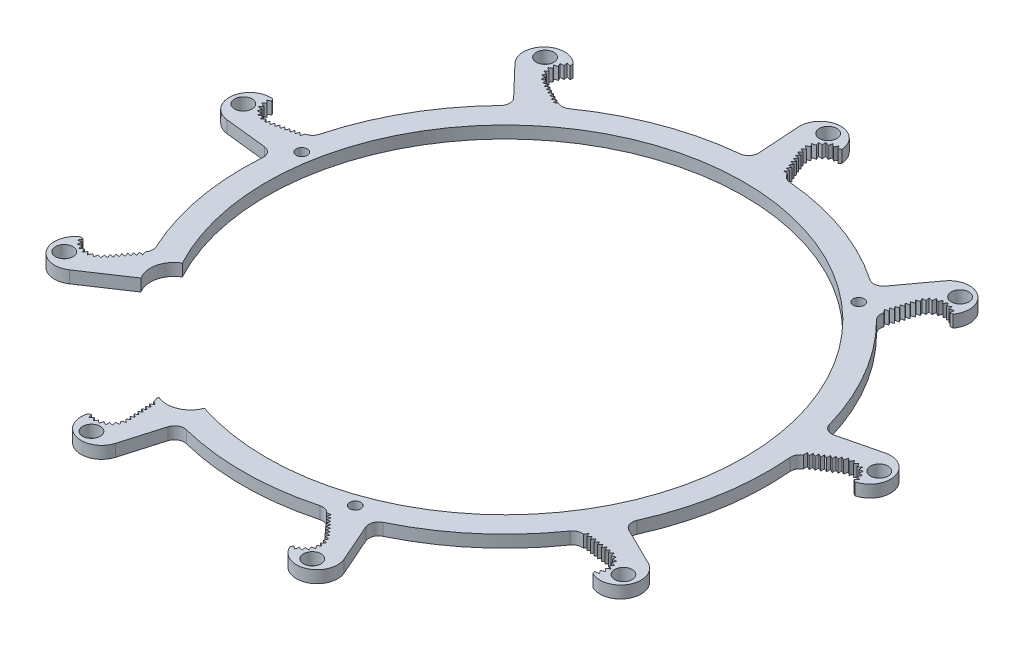
from build123d import *

# Parameters (mm, degrees)
SKETCH1_R           = 68.58
SKETCH1_R_2         = 55.88
BOSS_EXTRUDE1_DEPTH = 3.175
BOSS_EXTRUDE2_START = -3.175
BOSS_EXTRUDE2_DEPTH = 3.175
CIRPATTERN1_COUNT   = 9
SKETCH4_R           = 1.27
CUT_EXTRUDE1_DEPTH  = 124.088082607
CIRPATTERN14_COUNT  = 4
SKETCH5_R           = 62.357
CUT_EXTRUDE2_DEPTH  = 124.088082607
CUT_EXTRUDE3_DEPTH  = 124.088082607
SKETCH7_R           = 1.4605
CUT_EXTRUDE4_DEPTH  = 124.088082607
CIRPATTERN15_COUNT  = 3
CUT_EXTRUDE5_DEPTH  = 124.088082607
CRVPATTERN1_DEPTH   = 3.175
CIRPATTERN16_COUNT  = 9
CUT_EXTRUDE6_DEPTH  = 124.088082607
SKETCH3_R           = 2.286
CUT_EXTRUDE7_DEPTH  = 124.088082607
CIRPATTERN17_COUNT  = 9


# Read off the part's stored shape, not the designer's step: CrvPattern1
with BuildPart() as part:
    # Sketch1 → Boss-Extrude1 (new body)
    with BuildSketch(Plane(origin=(0, 0, 0), x_dir=(1, 0, 0), z_dir=(0, 1, 0))):
        with Locations(Location((0, 0, 0), (0, 0, 270))):
            Circle(SKETCH1_R)
        with Locations(Location((0, 0, 0), (0, 0, 270))):
            Circle(SKETCH1_R_2, mode=Mode.SUBTRACT)
    extrude(amount=BOSS_EXTRUDE1_DEPTH)

    # Sketch2 → Boss-Extrude2 (add)
    with BuildSketch(Plane(origin=(0, 3.175, 0), x_dir=(1, 0, 0), z_dir=(0, 1, 0)).offset(BOSS_EXTRUDE2_START)):
        with BuildLine():
            Line((-4.648503105, 70.922452149), (-5.367925957, 81.898723786))
            ThreePointArc((-5.367925957, 81.898723786), (0, 87.63), (5.367925957, 81.898723786))
            ThreePointArc((5.367925957, 81.898723786), (1.585103244, 80.66312392), (0.966324082, 76.732021396))
            Line((0.966324082, 76.732021396), (3.81, 69.87951531))
            ThreePointArc((3.81, 69.87951531), (4.65537594, 68.803759817), (5.936157335, 68.322605601))
            ThreePointArc((5.936157335, 68.322605601), (-0.497376724, 68.578196363), (-6.926526743, 68.22931648))
            ThreePointArc((-6.926526743, 68.22931648), (-5.243785443, 69.115963701), (-4.648503105, 70.922452149))
        make_face()
    boss_extrude2 = extrude(amount=BOSS_EXTRUDE2_DEPTH)

    # CirPattern1: Boss-Extrude2 ×9 about axis
    cirpattern1_axis = Axis((0, 0, 0), (0, 1, 0))
    for i in range(1, CIRPATTERN1_COUNT):
        add(boss_extrude2.rotate(cirpattern1_axis, i * 360 / CIRPATTERN1_COUNT))

    # Sketch4 → Cut-Extrude1 (cut, through all)
    with BuildSketch(Plane(origin=(0, 3.175, 0), x_dir=(1, 0, 0), z_dir=(0, 1, 0))):
        with Locations(Location((53.522006363, 24.957721447, 0), (0, 0, 270))):
            Circle(SKETCH4_R)
    cut_extrude1 = extrude(amount=-CUT_EXTRUDE1_DEPTH, mode=Mode.SUBTRACT)

    # CirPattern14: Cut-Extrude1 ×4 about axis
    cirpattern14_axis = Axis((0, 0, 0), (0, 1, 0))
    for i in range(1, CIRPATTERN14_COUNT):
        add(cut_extrude1.rotate(cirpattern14_axis, i * 360 / CIRPATTERN14_COUNT), mode=Mode.SUBTRACT)

    # Sketch5 → Cut-Extrude2 (cut, through all)
    with BuildSketch(Plane(origin=(0, 3.175, 0), x_dir=(1, 0, 0), z_dir=(0, 1, 0))):
        with Locations(Location((0, 0, 0), (0, 0, 270))):
            Circle(SKETCH5_R)
    extrude(amount=-CUT_EXTRUDE2_DEPTH, mode=Mode.SUBTRACT)

    # Sketch6 → Cut-Extrude3 (cut, through all)
    with BuildSketch(Plane(origin=(0, 3.175, 0), x_dir=(1, 0, 0), z_dir=(0, 1, 0))):
        with BuildLine():
            Line((-59.096393707, -39.486947853), (-51.847950614, -34.64369302))
            ThreePointArc((-51.847950614, -34.64369302), (-40.082306977, -47.76823334), (-25.11407534, -57.076077903))
            Line((-25.11407534, -57.076077903), (-27.81396741, -63.212049387))
            ThreePointArc((-27.81396741, -63.212049387), (-28.299348207, -62.604322733), (-28.945870603, -62.171962934))
            ThreePointArc((-28.945870603, -62.171962934), (-43.700202241, -52.853653839), (-55.625057983, -40.113206359))
            ThreePointArc((-55.625057983, -40.113206359), (-57.234287651, -39.099233257), (-59.096393707, -39.486947853))
        make_face()
    extrude(amount=-CUT_EXTRUDE3_DEPTH, mode=Mode.SUBTRACT)

    # Sketch7 → Cut-Extrude4 (cut, through all)
    with BuildSketch(Plane(origin=(0, 3.175, 0), x_dir=(1, 0, 0), z_dir=(0, 1, 0))):
        with Locations(Location((42.123157638, 50.200424446, 0), (0, 0, 270))):
            Circle(SKETCH7_R)
    cut_extrude4 = extrude(amount=-CUT_EXTRUDE4_DEPTH, mode=Mode.SUBTRACT)

    # CirPattern15: Cut-Extrude4 ×3 about axis
    cirpattern15_axis = Axis((0, 0, 0), (0, 1, 0))
    for i in range(1, CIRPATTERN15_COUNT):
        add(cut_extrude4.rotate(cirpattern15_axis, i * 360 / CIRPATTERN15_COUNT), mode=Mode.SUBTRACT)

    # Sketch9 → Cut-Extrude5 (cut, through all)
    with BuildSketch(Plane(origin=(0, 3.175, 0), x_dir=(1, 0, 0), z_dir=(0, 1, 0))):
        Polygon((3.47094583, 71.027887706), (2.775929115, 70.051961086), (3.957724412, 69.854880199), align=None)
    cut_extrude5 = extrude(amount=-CUT_EXTRUDE5_DEPTH, mode=Mode.SUBTRACT)

    # CrvPattern1 outline → CrvPattern1 (cut)
    with BuildSketch(Plane(origin=(0, 0, 0), x_dir=(1, 0, 0), z_dir=(0, 1, 0))):
        with BuildLine():
            Line((2.954390649, 71.893612642), (2.35875647, 71.057236713))
            Line((2.35875647, 71.057236713), (3.371563294, 70.888337016))
            Line((3.371563294, 70.888337016), (3.38406874, 70.905896878))
            Line((3.38406874, 70.905896878), (0.966324082, 76.732021396))
            ThreePointArc((0.966324082, 76.732021396), (1.585103244, 80.66312392), (5.367925957, 81.898723786))
            ThreePointArc((5.367925957, 81.898723786), (5.37940733, 82.230759048), (5.370370135, 82.562869823))
            Line((5.370370135, 82.562869823), (4.835817307, 82.035720051))
            Line((4.835817307, 82.035720051), (4.241589962, 82.88503055))
            Line((4.241589962, 82.88503055), (3.738556552, 81.978723842))
            Line((3.738556552, 81.978723842), (2.929076067, 82.62616172))
            Line((2.929076067, 82.62616172), (2.701825603, 81.614830079))
            Line((2.701825603, 81.614830079), (1.74270305, 82.007918354))
            Line((1.74270305, 82.007918354), (1.809654933, 80.973533557))
            Line((1.809654933, 80.973533557), (0.778630371, 81.080411122))
            Line((0.778630371, 81.080411122), (1.13435793, 80.106813481))
            Line((1.13435793, 80.106813481), (0.114999311, 79.918817556))
            Line((0.114999311, 79.918817556), (0.73066965, 79.084920383))
            Line((0.73066965, 79.084920383), (-0.194400635, 78.617288659))
            Line((-0.194400635, 78.617288659), (0.631310365, 77.990682079))
            Line((0.631310365, 77.990682079), (-0.124491578, 77.281317657))
            Line((-0.124491578, 77.281317657), (0.859335479, 76.907083655))
            Line((0.859335479, 76.907083655), (0.272893244, 76.083614844))
            Line((0.272893244, 76.083614844), (1.285700068, 75.914715147))
            Line((1.285700068, 75.914715147), (0.690065889, 75.078339218))
            Line((0.690065889, 75.078339218), (1.702872713, 74.909439521))
            Line((1.702872713, 74.909439521), (1.107238535, 74.073063591))
            Line((1.107238535, 74.073063591), (2.120045358, 73.904163894))
            Line((2.120045358, 73.904163894), (1.52441118, 73.067787965))
            Line((1.52441118, 73.067787965), (2.537218003, 72.898888268))
            Line((2.537218003, 72.898888268), (1.941583825, 72.062512339))
            Line((1.941583825, 72.062512339), (2.954390649, 71.893612642))
        make_face()
    crvpattern1 = extrude(amount=CRVPATTERN1_DEPTH, mode=Mode.SUBTRACT)

    # CirPattern16: Cut-Extrude5, CrvPattern1 ×9 about axis
    cirpattern16_axis = Axis((0, 0, 0), (0, 1, 0))
    add([cut_extrude5.rotate(cirpattern16_axis, i * 360 / CIRPATTERN16_COUNT) for i in range(1, CIRPATTERN16_COUNT)], mode=Mode.SUBTRACT)
    add([crvpattern1.rotate(cirpattern16_axis, i * 360 / CIRPATTERN16_COUNT) for i in range(1, CIRPATTERN16_COUNT)], mode=Mode.SUBTRACT)

    # Sketch10 → Cut-Extrude6 (cut, through all)
    with BuildSketch(Plane(origin=(0, 3.175, 0), x_dir=(1, 0, 0), z_dir=(0, 1, 0))):
        with BuildLine():
            Line((-48.136758931, -39.638969318), (-30.677903839, -54.288688187))
            ThreePointArc((-30.677903839, -54.288688187), (-19.259707874, -54.966075398), (-27.620367991, -62.772061238))
            ThreePointArc((-27.620367991, -62.772061238), (-44.082374272, -52.535327909), (-57.022186012, -38.10100658))
            ThreePointArc((-57.022186012, -38.10100658), (-50.78660403, -28.511868461), (-48.136758931, -39.638969318))
        make_face()
    extrude(amount=-CUT_EXTRUDE6_DEPTH, mode=Mode.SUBTRACT)

    # Sketch3 → Cut-Extrude7 (cut, through all)
    with BuildSketch(Plane(origin=(0, 3.175, 0), x_dir=(1, 0, 0), z_dir=(0, 1, 0))):
        with Locations(Location((0, 84.328, 0), (0, 0, 270))):
            Circle(SKETCH3_R)
    cut_extrude7 = extrude(amount=-CUT_EXTRUDE7_DEPTH, mode=Mode.SUBTRACT)

    # CirPattern17: Cut-Extrude7 ×9 about axis
    cirpattern17_axis = Axis((0, 0, 0), (0, 1, 0))
    for i in range(1, CIRPATTERN17_COUNT):
        add(cut_extrude7.rotate(cirpattern17_axis, i * 360 / CIRPATTERN17_COUNT), mode=Mode.SUBTRACT)


solid = part.part
